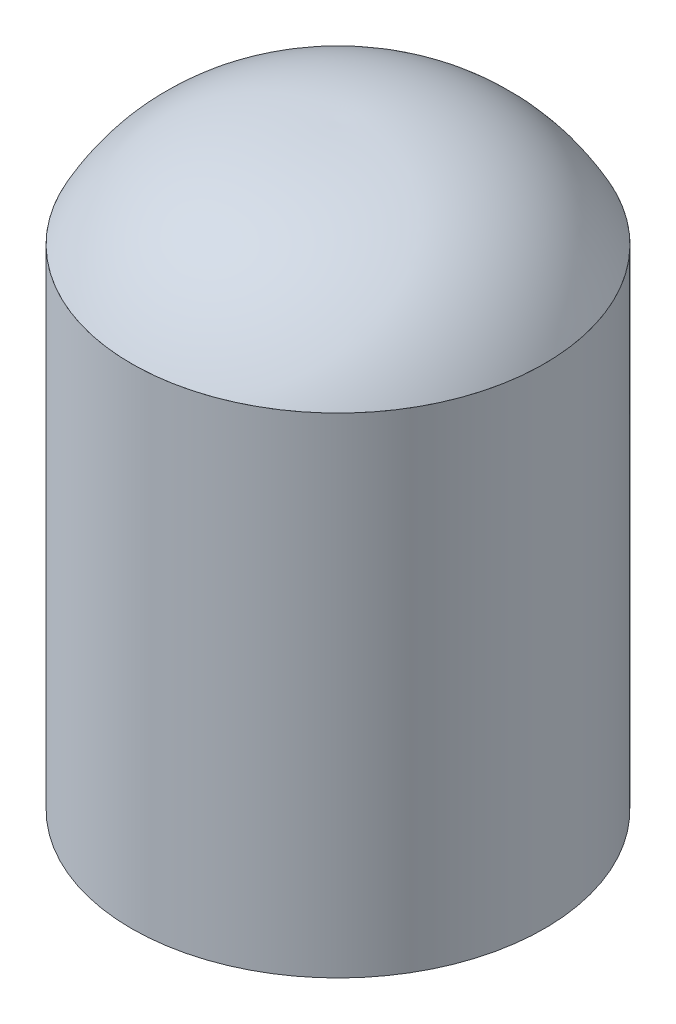
from build123d import *

# Parameters (mm, degrees)
SKETCH1_3_W = 5.334
SKETCH1_3_H = 87.884


with BuildPart() as part:
    # Sketch1 → Revolve1 (revolve)
    with BuildSketch(Plane.XY):
        with BuildLine():
            Line((-31.75, 0), (0, 0))
            Line((0, 0), (0, 19.05))
            add(Edge.make_bspline(
                [(0, 19.05), (-26.26101489, 19.803937268), (-37.084, 0)],
                knots=[0, 0, 0, 1, 1, 1], degree=2))
            Line((-37.084, 0), (-31.75, 0))
        make_face()
    revolve(axis=Axis((0, 0, 0), (0, 1, 0)))


with BuildPart() as body_2:
    # Sketch1<3> → Revolve2 (revolve)
    with BuildSketch(Plane.XY):
        with Locations((-34.417, -43.942)):
            Rectangle(SKETCH1_3_W, SKETCH1_3_H)
    revolve(axis=Axis((0, 0, 0), (0, -1, 0)))


solid = Compound([part.part, body_2.part])
